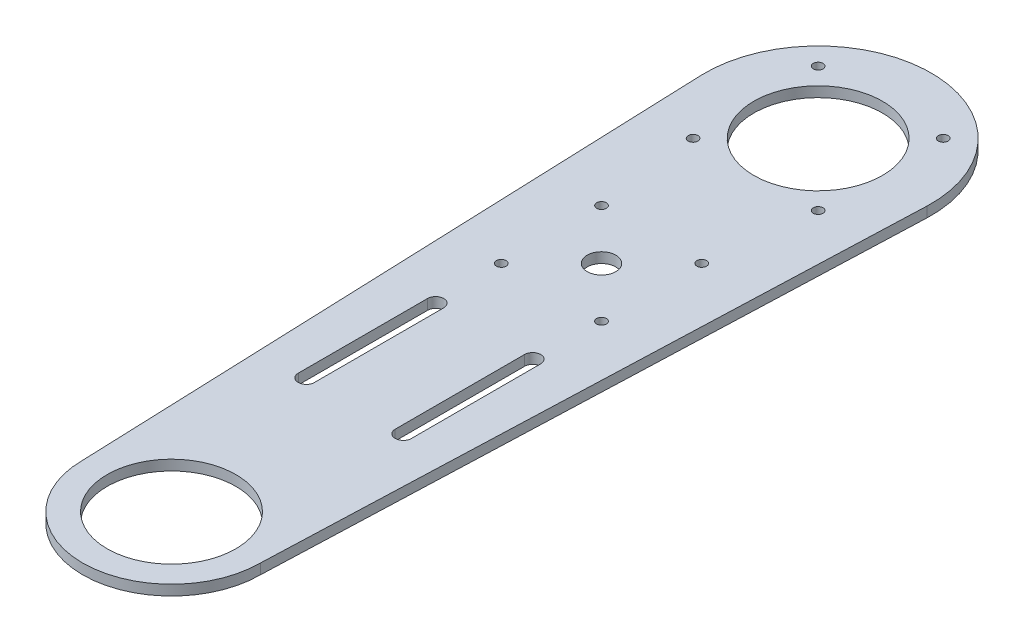
from build123d import *

# Parameters (mm, degrees)
BOSS_EXTRUDE1_DEPTH     = 3.175
SKETCH2_R               = 19.9
CUT_EXTRUDE1_DEPTH      = 140.49939292
ESQUISSE2_R             = 1.5
ENL_V_MAT_EXTRU_1_DEPTH = 140.49939292
SKETCH3_R               = 4.425
CUT_EXTRUDE2_DEPTH      = 140.49939292
CUT_EXTRUDE4_DEPTH      = 140.49939292
SKETCH6_R               = 1.5
CUT_EXTRUDE5_DEPTH      = 140.49939292


with BuildPart() as part:
    # Sketch1 → Boss-Extrude1 (new body)
    with BuildSketch(Plane(origin=(0, 0, 0), x_dir=(1, 0, 0), z_dir=(0, 1, 0))):
        with BuildLine():
            Line((-34.975254116, 98.684097441), (-27.5, -100))
            ThreePointArc((-27.5, -100), (0, -127.5), (27.5, -100))
            Line((27.5, -100), (34.975254116, 98.684097441))
            ThreePointArc((34.975254116, 98.684097441), (0, 135), (-34.975254116, 98.684097441))
        make_face()
    extrude(amount=BOSS_EXTRUDE1_DEPTH)

    # Sketch2 → Cut-Extrude1 (cut, through all)
    with BuildSketch(Plane(origin=(0, 3.175, 0), x_dir=(1, 0, 0), z_dir=(0, 1, 0))):
        with Locations((0, -100)):
            Circle(SKETCH2_R)
        with Locations((0, 100)):
            Circle(SKETCH2_R)
    extrude(amount=-CUT_EXTRUDE1_DEPTH, mode=Mode.SUBTRACT)

    # Esquisse2 → Enlèv. mat.-Extru.1 (cut, through all)
    with BuildSketch(Plane(origin=(0, 3.175, 0), x_dir=(1, 0, 0), z_dir=(0, 1, 0))):
        with Locations((19.339370465, 80.660629535)):
            Circle(ESQUISSE2_R)
        with Locations((19.339370465, 119.339370465)):
            Circle(ESQUISSE2_R)
        with Locations((-19.339370465, 119.339370465)):
            Circle(ESQUISSE2_R)
        with Locations((-19.339370465, 80.660629535)):
            Circle(ESQUISSE2_R)
    extrude(amount=-ENL_V_MAT_EXTRU_1_DEPTH, mode=Mode.SUBTRACT)

    # Sketch3 → Cut-Extrude2 (cut, through all)
    with BuildSketch(Plane(origin=(0, 3.175, 0), x_dir=(1, 0, 0), z_dir=(0, 1, 0))):
        with Locations((0, 33)):
            Circle(SKETCH3_R)
    extrude(amount=-CUT_EXTRUDE2_DEPTH, mode=Mode.SUBTRACT)

    # Sketch5 → Cut-Extrude4 (cut, through all)
    with BuildSketch(Plane(origin=(0, 3.175, 0), x_dir=(1, 0, 0), z_dir=(0, 1, 0))):
        with BuildLine():
            Line((-17.5, -43.3), (-17.5, -3.3))
            ThreePointArc((-17.5, -3.3), (-15, -0.8), (-12.5, -3.3))
            Line((-12.5, -3.3), (-12.5, -43.3))
            ThreePointArc((-12.5, -43.3), (-15, -45.8), (-17.5, -43.3))
        make_face()
        with BuildLine():
            Line((12.5, -43.3), (12.5, -3.3))
            ThreePointArc((12.5, -3.3), (15, -0.8), (17.5, -3.3))
            Line((17.5, -3.3), (17.5, -43.3))
            ThreePointArc((17.5, -43.3), (15, -45.8), (12.5, -43.3))
        make_face()
    extrude(amount=-CUT_EXTRUDE4_DEPTH, mode=Mode.SUBTRACT)

    # Sketch6 → Cut-Extrude5 (cut, through all)
    with BuildSketch(Plane(origin=(0, 0, 0), x_dir=(-1, 0, 0), z_dir=(0, -1, 0))):
        with Locations((15.5, 17.5)):
            Circle(SKETCH6_R)
        with Locations((-15.5, 17.5)):
            Circle(SKETCH6_R)
        with Locations((-15.5, 48.5)):
            Circle(SKETCH6_R)
        with Locations((15.5, 48.5)):
            Circle(SKETCH6_R)
    extrude(amount=-CUT_EXTRUDE5_DEPTH, mode=Mode.SUBTRACT)


solid = part.part
